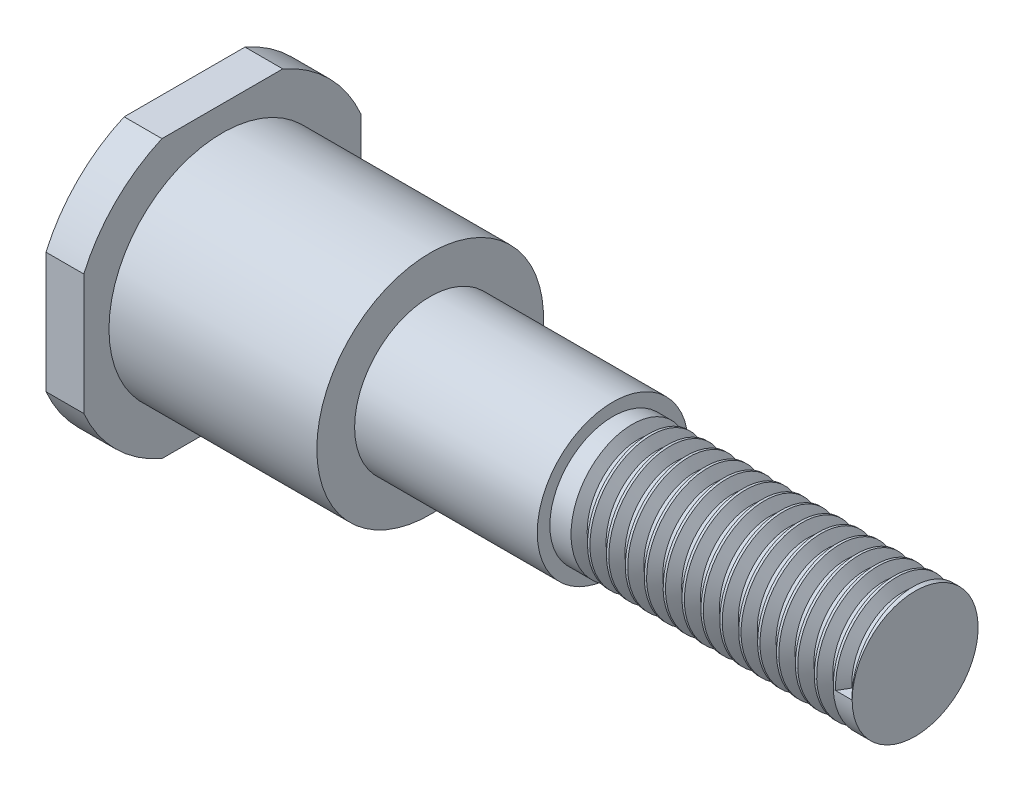
from build123d import *

# Parameters (mm, degrees)
SKETCH_5_OUTSIDE_W   = 39.44
SKETCH_5_OUTSIDE_H   = 39.44
SKETCH_5_OUTSIDE_W_2 = 22
SKETCH_5_OUTSIDE_H_2 = 22
CUT_EXTRUDE_1_DEPTH  = 61.431779719
THREAD_1_PITCH       = 1.5


with BuildPart() as part:
    # Sketch 1 → 旋转1 (revolve)
    with BuildSketch(Plane.XY, mode=Mode.PRIVATE) as revolve_1_sk:
        Polygon((0, 0), (0, 12), (3, 12), (3, 9), (19.5, 9), (19.5, 6), (34, 6), (34, 5), (58, 5), (58, 0), align=None)
    revolve(revolve_1_sk.sketch.rotate(Axis((-3.610162727, 0, 0), (1, 0, 0)), 90), axis=Axis((-3.610162727, 0, 0), (1, 0, 0)))

    # 草图5 outside → 切除-拉伸1 (cut, through all)
    with BuildSketch(Plane.ZY):
        Rectangle(SKETCH_5_OUTSIDE_W, SKETCH_5_OUTSIDE_H)
        Rectangle(SKETCH_5_OUTSIDE_W_2, SKETCH_5_OUTSIDE_H_2, mode=Mode.SUBTRACT)
    extrude(amount=-CUT_EXTRUDE_1_DEPTH, mode=Mode.SUBTRACT)

    # 螺纹线1: the profile of Sketch 1 2 profile screwed along a right-hand helix of 14.666667 turns, 8 arcs to a turn; built about Z, then put on its axis
    thread_1_z = Axis((0, 0, 0), (0, 0, 1))
    thread_1_corners = [(5.0003, 0, -0.000173205), (5.0003, 0, 1.312673201), (4.188101188, 0, 0.843749998), (4.188101188, 0, 0.468749998)]
    with BuildLine(mode=Mode.PRIVATE) as thread_1_profile:
        Line(thread_1_corners[0], thread_1_corners[1])
        Line(thread_1_corners[1], thread_1_corners[2])
        Line(thread_1_corners[2], thread_1_corners[3])
        Line(thread_1_corners[3], thread_1_corners[0])
    thread_1_cap = Face(thread_1_profile.wire())
    thread_1_turn_angles = [0, 22.5, 45, 67.5, 90, 112.5, 135, 157.5, 180, 202.5, 225, 247.5, 270, 292.5, 315, 337.5, 360]
    thread_1_turn_weights = [1, 0.9238795325112867, 1, 0.9238795325112867, 1, 0.9238795325112867, 1, 0.9238795325112867, 1, 0.9238795325112867, 1, 0.9238795325112867, 1, 0.9238795325112867, 1, 0.9238795325112867, 1]
    thread_1_turn_rails = [Edge.make_bspline([Vector(p[0], p[1], 0).rotate(thread_1_z, thread_1_turn_angles[k]) / thread_1_turn_weights[k] + Vector(0, 0, p[2] + THREAD_1_PITCH * thread_1_turn_angles[k] / 360) for k in range(17)], [0, 0, 0, 1, 1, 2, 2, 3, 3, 4, 4, 5, 5, 6, 6, 7, 7, 8, 8, 8], 2, thread_1_turn_weights) for p in thread_1_corners]
    thread_1_turn_sides = [Face.make_surface_from_curves(thread_1_turn_rails[p[0]], thread_1_turn_rails[p[1]]) for p in [(0, 1), (1, 2), (2, 3), (3, 0)]]
    thread_1_last_angles = [5040, 5062.5, 5085, 5107.5, 5130, 5152.5, 5175, 5197.5, 5220, 5242.5, 5265, 5272.5, 5280]
    thread_1_last_weights = [1, 0.9238795325112867, 1, 0.9238795325112867, 1, 0.9238795325112867, 1, 0.9238795325112867, 1, 0.9238795325112867, 1, 0.9914448613738115, 1]
    thread_1_last_rails = [Edge.make_bspline([Vector(p[0], p[1], 0).rotate(thread_1_z, thread_1_last_angles[k]) / thread_1_last_weights[k] + Vector(0, 0, p[2] + THREAD_1_PITCH * thread_1_last_angles[k] / 360) for k in range(13)], [0, 0, 0, 1, 1, 2, 2, 3, 3, 4, 4, 5, 5, 6, 6, 6], 2, thread_1_last_weights) for p in thread_1_corners]
    thread_1_last_sides = [Face.make_surface_from_curves(thread_1_last_rails[p[0]], thread_1_last_rails[p[1]]) for p in [(0, 1), (1, 2), (2, 3), (3, 0)]]
    thread_1 = Plane(origin=(58, 0, 0), x_dir=(0, 0, 1), z_dir=(-1, 0, 0)) * Solid(Shell([*[p.moved(Location((0, 0, THREAD_1_PITCH * i))) for i in range(14) for p in thread_1_turn_sides], *thread_1_last_sides, thread_1_cap, thread_1_cap.rotate(thread_1_z, 5280).moved(Location((0, 0, THREAD_1_PITCH * 5280 / 360)))]))
    add(thread_1, mode=Mode.SUBTRACT)


solid = part.part
